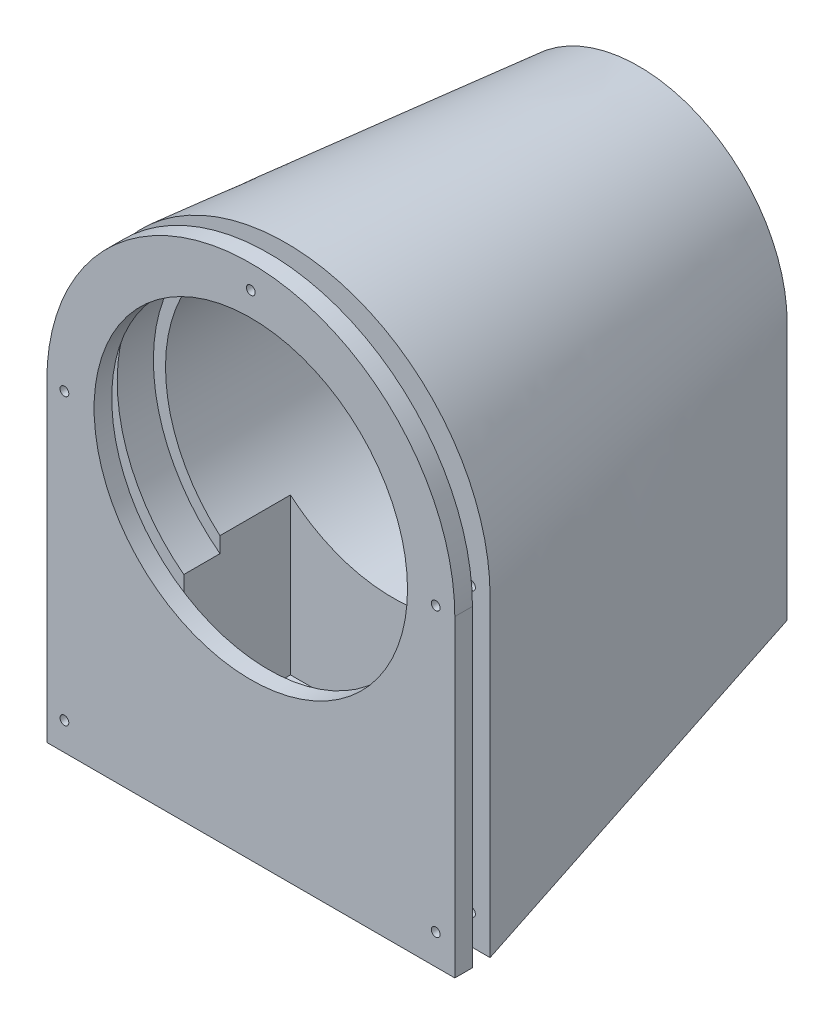
from build123d import *

# Parameters (mm, degrees)
ESBO_O3_R                = 17.775
CORTE_EXTRUS_O2_DEPTH    = 27
ESBO_O5_W                = 18.2
ESBO_O5_H                = 5
CORTE_EXTRUS_O3_DEPTH    = 12
ESBO_O6_W                = 9
ESBO_O6_H                = 4
CORTE_EXTRUS_O4_DEPTH    = 12
CORTE_EXTRUS_O5_DEPTH    = 4.1
ESBO_O9_W                = 23.13978744
ESBO_O9_H                = 20.617894971
CORTE_EXTRUS_O6_DEPTH    = 8
ESBO_O10_R               = 17.775
RESSALTO_EXTRUS_O1_DEPTH = 2
ESBO_O11_R               = 0.5
CORTE_EXTRUS_O7_DEPTH    = 12


with BuildPart() as part:
    # Loft1: read off the stored shape, not the designer's step
    # Loft1: loft between two sections, ruled curve by curve
    loft1_from = [
        Edge.make_bspline([(16.839285714, -25.5, -40), (16.839285714, -23.163313322, -40), (16.839285714, -18.358176955, -40), (16.839285714, -10.919642857, -40), (16.839285714, -3.481108759, -40), (16.839285714, 1.324027608, -40), (16.839285714, 4.786186161, -40), (16.611276147, 7.027198338, -40), (15.295049421, 11.304306095, -40), (12.13405931, 15.956740347, -40), (6.544528745, 19.642888976, -40), (0, 20.929296705, -40), (-6.544528745, 19.642888976, -40), (-12.13405931, 15.956740347, -40), (-15.295049421, 11.304306095, -40), (-16.611276147, 7.027198338, -40), (-16.839285714, 4.786186161, -40), (-16.839285714, 3.660714286, -40)], [0, 0, 0, 0, 0.085423021, 0.170846042, 0.256269063, 0.341692084, 0.341692084, 0.382836329, 0.423980574, 0.506269063, 0.588557553, 0.670846042, 0.753134532, 0.835423021, 0.917711511, 0.958855755, 1, 1, 1, 1], 3),
        Edge.make_line((-16.839285714, 3.660714286, -40), (-16.839285714, -25.5, -40)),
        Edge.make_line((-16.839285714, -25.5, -40), (16.839285714, -25.5, -40)),
    ]
    loft1_to = [
        Edge.make_bspline([(23.139172611, -35.5, 0), (23.139172611, -32.419251356, 0), (23.139172611, -26.452157178, 0), (23.139172611, -17.75, 0), (23.139172611, -9.047842822, 0), (23.139172611, -3.080748644, 0), (23.139172611, 1.483851466, 0), (22.851558574, 4.462401025, 0), (21.134983596, 10.237959163, 0), (16.9026912, 16.679187276, 0), (9.180031183, 21.908054295, 0), (0, 23.75609401, 0), (-9.180031183, 21.908054295, 0), (-16.9026912, 16.679187276, 0), (-21.134983596, 10.237959163, 0), (-22.851558574, 4.462401025, 0), (-23.139172611, 1.483851466, 0), (-23.139172611, 0, 0)], [0, 0, 0, 0, 0.085423021, 0.170846042, 0.256269063, 0.341692084, 0.341692084, 0.382836329, 0.423980574, 0.506269063, 0.588557553, 0.670846042, 0.753134532, 0.835423021, 0.917711511, 0.958855755, 1, 1, 1, 1], 3),
        Edge.make_line((-23.139172611, 0, 0), (-23.139172611, -35.5, 0)),
        Edge.make_line((-23.139172611, -35.5, 0), (23.139172611, -35.5, 0)),
    ]
    loft1 = Solid(Shell([*[Face.make_surface_from_curves(loft1_from[k], loft1_to[k]) for k in range(3)], Face(Wire(loft1_from)), Face(Wire(loft1_to))]))
    add(loft1)

    # Esboço3 → Corte-extrusão2 (cut)
    with BuildSketch(Plane.XY):
        Circle(ESBO_O3_R)
    extrude(amount=-CORTE_EXTRUS_O2_DEPTH, mode=Mode.SUBTRACT)

    # Esboço5 → Corte-extrusão3 (cut)
    with BuildSketch(Plane.XY.offset(-27)):
        Rectangle(ESBO_O5_W, ESBO_O5_H)
    extrude(amount=-CORTE_EXTRUS_O3_DEPTH, mode=Mode.SUBTRACT)

    # Esboço6 → Corte-extrusão4 (cut)
    with BuildSketch(Plane.XY.offset(-39)):
        with Locations((0, 0.5)):
            Rectangle(ESBO_O6_W, ESBO_O6_H)
    extrude(amount=-CORTE_EXTRUS_O4_DEPTH, mode=Mode.SUBTRACT)

    # Esboço8 → Corte-extrusão5 (cut)
    with BuildSketch(Plane.XY):
        with BuildLine():
            Line((11.6, -15.236879602), (11.6, -31.15))
            Line((11.6, -31.15), (-11.6, -31.15))
            Line((-11.6, -31.15), (-11.6, -15.236879602))
            ThreePointArc((-11.6, -15.236879602), (0, 19.15), (11.6, -15.236879602))
        make_face()
    extrude(amount=-CORTE_EXTRUS_O5_DEPTH, mode=Mode.SUBTRACT)

    # Esboço9 → Corte-extrusão6 (cut)
    with BuildSketch(Plane.XY.offset(-4.1)):
        with Locations((-0.03010628, -20.841052514)):
            Rectangle(ESBO_O9_W, ESBO_O9_H)
    extrude(amount=-CORTE_EXTRUS_O6_DEPTH, mode=Mode.SUBTRACT)


with BuildPart() as body_2:
    # Esboço10 → Ressalto-extrusão1 (new body)
    with BuildSketch(Plane.XY.offset(2)):
        with BuildLine():
            Line((23.139172611, -35.5), (23.139172611, 0))
            ThreePointArc((23.139172611, 0), (0, 23.139172611), (-23.139172611, 0))
            Line((-23.139172611, 0), (-23.139172611, -35.5))
            Line((-23.139172611, -35.5), (23.139172611, -35.5))
        make_face()
        Circle(ESBO_O10_R, mode=Mode.SUBTRACT)
    extrude(amount=RESSALTO_EXTRUS_O1_DEPTH)


with BuildPart() as corte_extrus_o7_tool:
    # Esboço11 → Corte-extrusão7 (new body)
    with BuildSketch(Plane.XY.offset(4)):
        with Locations((0, 20.5)):
            Circle(ESBO_O11_R)
        with Locations((-21.140831683, 0)):
            Circle(ESBO_O11_R)
        with Locations((20.974695481, 0)):
            Circle(ESBO_O11_R)
        with Locations((-21.140831683, -32.327973325)):
            Circle(ESBO_O11_R)
        with Locations((20.974695481, -32.064260334)):
            Circle(ESBO_O11_R)
    extrude(amount=-CORTE_EXTRUS_O7_DEPTH)


with BuildPart() as part_1:
    add(part.part)

    # Corte-extrusão7: cut by corte_extrus_o7_tool
    add(corte_extrus_o7_tool.part, mode=Mode.SUBTRACT)


with BuildPart() as body_2_1:
    add(body_2.part)

    # Corte-extrusão7: cut by corte_extrus_o7_tool
    add(corte_extrus_o7_tool.part, mode=Mode.SUBTRACT)


solid = Compound([part_1.part, body_2_1.part])
